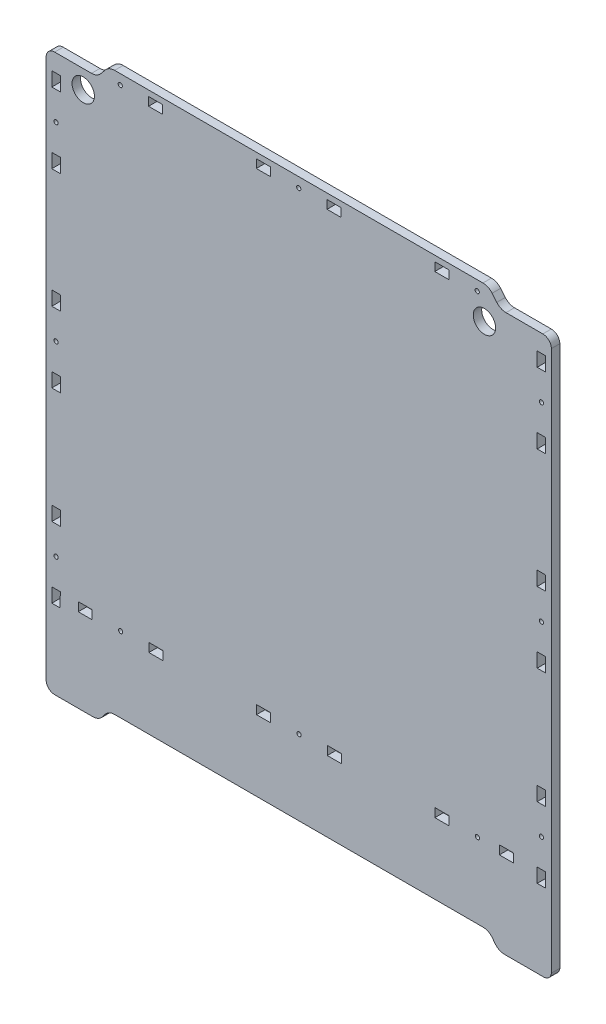
from build123d import *

# Parameters (mm, degrees)
SKETCH_1_R      = 1.5
SKETCH_1_R_2    = 7.9
SKETCH_1_W      = 6
SKETCH_1_H      = 10
SKETCH_1_W_2    = 9.974357274
SKETCH_1_H_2    = 6.199787221
SKETCH_1_W_3    = 9.96963529
SKETCH_1_W_4    = 9.994814167
SKETCH_1_H_3    = 6.199822499
SKETCH_1_W_5    = 9.849167249
SKETCH_1_W_6    = 9.849167498
SKETCH_1_W_7    = 10
SKETCH_1_H_4    = 6
SKETCH_1_W_8    = 9.949996323
EXTRUDE_1_DEPTH = 6


with BuildPart() as part:
    # Эскиз1 → Бобышка-Вытянуть1 (new body)
    with BuildSketch(Plane.XY):
        with BuildLine():
            Line((146.861398458, 191.532325026), (172.897783364, 191.532325026))
            ThreePointArc((172.897783364, 191.532325026), (177.136670981, 189.778724862), (178.897783364, 185.542952802))
            Line((178.897783364, 185.542952802), (178.897783364, -196.675834418))
            ThreePointArc((178.897783364, -196.675834418), (176.952338072, -200.464395383), (172.897783364, -201.767674974))
            Line((172.897783364, -201.767674974), (145.861398458, -201.767674974))
            ThreePointArc((145.861398458, -201.767674974), (142.269143233, -200.971291164), (139.350020692, -198.731369657))
            Line((139.350020692, -198.731369657), (137.054194639, -195.711716561))
            ThreePointArc((137.054194639, -195.711716561), (134.135072097, -193.471795054), (130.542816872, -192.675411244))
            Line((130.542816872, -192.675411244), (-129.747250144, -192.675411244))
            ThreePointArc((-129.747250144, -192.675411244), (-133.339505369, -193.471795054), (-136.258627911, -195.711716561))
            Line((-136.258627911, -195.711716561), (-138.554453964, -198.731369657))
            ThreePointArc((-138.554453964, -198.731369657), (-141.473576506, -200.971291164), (-145.06583173, -201.767674974))
            Line((-145.06583173, -201.767674974), (-172.102216636, -201.767674974))
            ThreePointArc((-172.102216636, -201.767674974), (-176.344857323, -200.010315661), (-178.102216636, -195.767674974))
            Line((-178.102216636, -195.767674974), (-178.102216636, 185.542952802))
            ThreePointArc((-178.102216636, 185.542952802), (-176.341104253, 189.778724862), (-172.102216636, 191.532325026))
            Line((-172.102216636, 191.532325026), (-146.06583173, 191.532325026))
            ThreePointArc((-146.06583173, 191.532325026), (-142.473576506, 192.328708836), (-139.554453964, 194.568630343))
            Line((-139.554453964, 194.568630343), (-136.258627911, 198.496442883))
            ThreePointArc((-136.258627911, 198.496442883), (-133.339449219, 200.73613298), (-129.747250144, 201.532325026))
            Line((-129.747250144, 201.532325026), (130.542816872, 201.532325026))
            ThreePointArc((130.542816872, 201.532325026), (134.135072097, 200.735941215), (137.054194639, 198.496019708))
            Line((137.054194639, 198.496019708), (140.350020692, 194.568207169))
            ThreePointArc((140.350020692, 194.568207169), (143.269199383, 192.328517071), (146.861398458, 191.532325026))
        make_face()
        with Locations((126.685666009, -139.542345576)):
            Circle(SKETCH_1_R, mode=Mode.SUBTRACT)
        with Locations((0.618552859, -139.542345576)):
            Circle(SKETCH_1_R, mode=Mode.SUBTRACT)
        with Locations((-125.506683527, -139.542345576)):
            Circle(SKETCH_1_R, mode=Mode.SUBTRACT)
        with Locations((-171.102216636, -116.737674974)):
            Circle(SKETCH_1_R, mode=Mode.SUBTRACT)
        with Locations((-171.102216636, 14.972325026)):
            Circle(SKETCH_1_R, mode=Mode.SUBTRACT)
        with Locations((171.897783364, 149.132325026)):
            Circle(SKETCH_1_R, mode=Mode.SUBTRACT)
        with Locations((126.537783364, 194.532325026)):
            Circle(SKETCH_1_R, mode=Mode.SUBTRACT)
        with Locations((-151.902216636, 178.532325026)):
            Circle(SKETCH_1_R_2, mode=Mode.SUBTRACT)
        with Locations((171.897783364, -116.737674974)):
            Circle(SKETCH_1_R, mode=Mode.SUBTRACT)
        with Locations((171.897783364, 14.972325026)):
            Circle(SKETCH_1_R, mode=Mode.SUBTRACT)
        with Locations((-171.102216636, 149.132325026)):
            Circle(SKETCH_1_R, mode=Mode.SUBTRACT)
        with Locations((-125.742216636, 194.532325026)):
            Circle(SKETCH_1_R, mode=Mode.SUBTRACT)
        with Locations((0.397783364, 194.54440539)):
            Circle(SKETCH_1_R, mode=Mode.SUBTRACT)
        with Locations((131.597783364, 178.532325026)):
            Circle(SKETCH_1_R_2, mode=Mode.SUBTRACT)
        with Locations((-171.102216636, 39.972325026)):
            Rectangle(SKETCH_1_W, SKETCH_1_H, mode=Mode.SUBTRACT)
        with Locations((171.897783364, 39.972325026)):
            Rectangle(SKETCH_1_W, SKETCH_1_H, mode=Mode.SUBTRACT)
        Polygon((174.897783364, 179.132325026), (174.897783364, 169.359038573), (174.897783364, 169.132325026), (168.897783364, 169.132325026), (168.897783364, 179.132325026), align=None, mode=Mode.SUBTRACT)
        Polygon((96.537783364, 197.532325026), (106.41988356, 197.532325026), (106.537783364, 197.514906712), (106.537783364, 191.332537312), (106.419882773, 191.532325026), (96.537783364, 191.532325026), align=None, mode=Mode.SUBTRACT)
        with Locations((25.533740214, -139.575517633)):
            Rectangle(SKETCH_1_W_2, SKETCH_1_H_2, mode=Mode.SUBTRACT)
        with Locations((-24.46393863, -139.575517633)):
            Rectangle(SKETCH_1_W_3, SKETCH_1_H_2, mode=Mode.SUBTRACT)
        with Locations((-171.102216636, 174.132325026)):
            Rectangle(SKETCH_1_W, SKETCH_1_H, mode=Mode.SUBTRACT)
        with Locations((101.618099825, -139.576911106)):
            Rectangle(SKETCH_1_W_4, SKETCH_1_H_3, mode=Mode.SUBTRACT)
        with Locations((147.077476572, -139.576911106)):
            Rectangle(SKETCH_1_W_5, SKETCH_1_H_3, mode=Mode.SUBTRACT)
        Polygon((-19.591640072, 191.532325026), (-29.591640255, 191.532325026), (-29.592789489, 197.532325026), (-19.592789306, 197.532325026), align=None, mode=Mode.SUBTRACT)
        with Locations((-171.102216636, 124.132325026)):
            Rectangle(SKETCH_1_W, SKETCH_1_H, mode=Mode.SUBTRACT)
        with Locations((-150.498155392, -139.576911106)):
            Rectangle(SKETCH_1_W_6, SKETCH_1_H_3, mode=Mode.SUBTRACT)
        with Locations((25.387783364, 194.532325026)):
            Rectangle(SKETCH_1_W_7, SKETCH_1_H_4, mode=Mode.SUBTRACT)
        with Locations((-171.102216636, -10.027674974)):
            Rectangle(SKETCH_1_W, SKETCH_1_H, mode=Mode.SUBTRACT)
        with Locations((-171.102216636, -91.757674974)):
            Rectangle(SKETCH_1_W, SKETCH_1_H, mode=Mode.SUBTRACT)
        Polygon((-174.102216636, -136.747674974), (-168.102216636, -136.747674974), (-168.289424992, -146.747674974), (-174.102216636, -146.747674974), align=None, mode=Mode.SUBTRACT)
        with Locations((-100.548530817, -139.576911106)):
            Rectangle(SKETCH_1_W_8, SKETCH_1_H_3, mode=Mode.SUBTRACT)
        with Locations((171.897783364, -10.027674974)):
            Rectangle(SKETCH_1_W, SKETCH_1_H, mode=Mode.SUBTRACT)
        with Locations((171.897783364, -91.757674974)):
            Rectangle(SKETCH_1_W, SKETCH_1_H, mode=Mode.SUBTRACT)
        with Locations((171.897783364, -141.747674974)):
            Rectangle(SKETCH_1_W, SKETCH_1_H, mode=Mode.SUBTRACT)
        with Locations((171.897783364, 124.132325026)):
            Rectangle(SKETCH_1_W, SKETCH_1_H, mode=Mode.SUBTRACT)
        Polygon((-95.741641469, 191.532325026), (-105.741641652, 191.532325026), (-105.742790886, 197.532325026), (-95.742790703, 197.532325026), align=None, mode=Mode.SUBTRACT)
    extrude(amount=EXTRUDE_1_DEPTH)


solid = part.part
